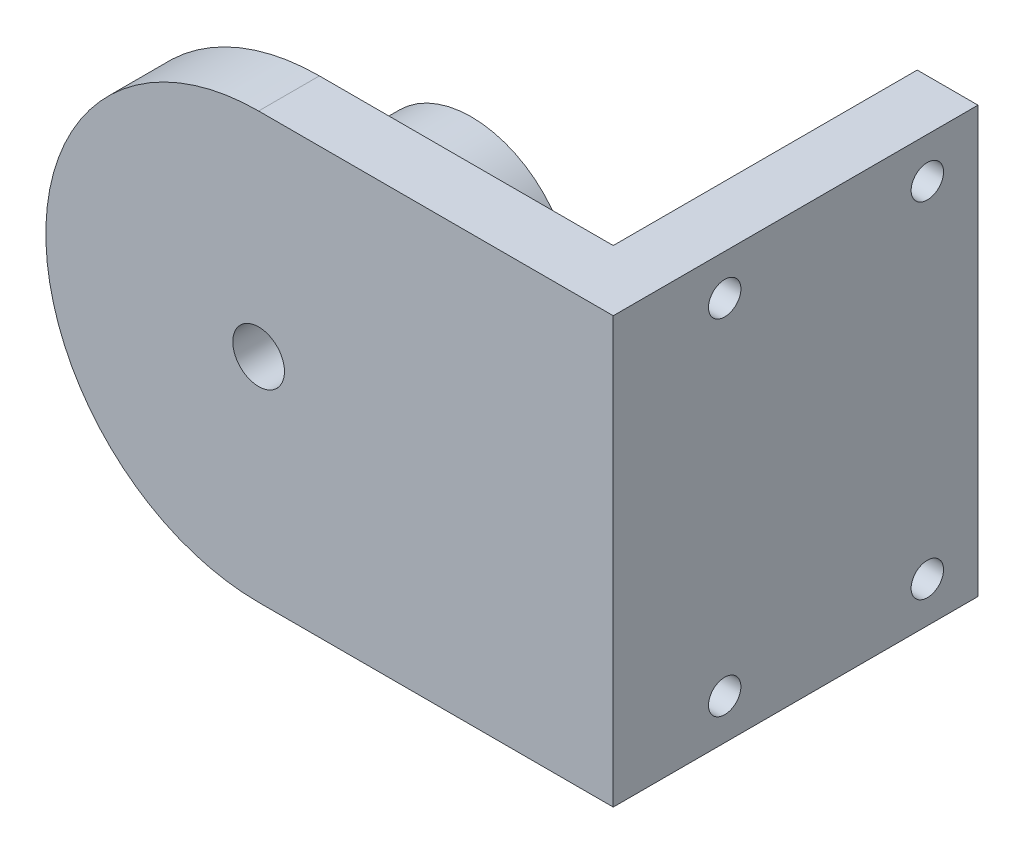
from build123d import *

# Parameters (mm, degrees)
SKETCH_1_R          = 10
SKETCH_1_R_2        = 2.55
EXTRUDE_1_DEPTH     = 15
SKETCH_3_R          = 1.6
CUT_EXTRUDE_1_DEPTH = 28.75853565
EXTRUDE_2_DEPTH     = 6
SKETCH_6_R          = 2.55
CUT_EXTRUDE_2_DEPTH = 10
SKETCH_7_W          = 30
SKETCH_7_H          = 42
EXTRUDE_3_DEPTH     = 6
SKETCH_8_R          = 1.6
CUT_EXTRUDE_3_DEPTH = 6


with BuildPart() as part:
    # 草图1 → 凸台-拉伸1 (new body)
    with BuildSketch(Plane.XY):
        with Locations((-2.14168272, 2.06384273)):
            Circle(SKETCH_1_R)
        with Locations((-2.14168272, 2.06384273)):
            Circle(SKETCH_1_R_2, mode=Mode.SUBTRACT)
    extrude(amount=EXTRUDE_1_DEPTH)

    # 草图3 → 切除-拉伸1 (cut, through all)
    with BuildSketch(Plane(origin=(7.85831728, 0, 0), x_dir=(0, 0, -1), z_dir=(1, 0, 0))):
        with Locations((-7.5, 2.06384273)):
            Circle(SKETCH_3_R)
    extrude(amount=-CUT_EXTRUDE_1_DEPTH, mode=Mode.SUBTRACT)

    # 草图5 → 凸台-拉伸2 (add)
    with BuildSketch(Plane.XY.offset(15)):
        with BuildLine():
            Line((-2.14168272, 23.06384273), (32.85831728, 23.06384273))
            Line((32.85831728, 23.06384273), (32.85831728, -18.93615727))
            Line((32.85831728, -18.93615727), (-2.14168272, -18.93615727))
            ThreePointArc((-2.14168272, -18.93615727), (-23.14168272, 2.06384273), (-2.14168272, 23.06384273))
        make_face()
    extrude(amount=EXTRUDE_2_DEPTH)

    # 草图6 → 切除-拉伸2 (cut)
    with BuildSketch(Plane(origin=(0, 0, 15), x_dir=(-1, 0, 0), z_dir=(0, 0, -1))):
        with Locations((2.14168272, 2.06384273)):
            Circle(SKETCH_6_R)
    extrude(amount=-CUT_EXTRUDE_2_DEPTH, mode=Mode.SUBTRACT)

    # 草图7 → 凸台-拉伸3 (add)
    with BuildSketch(Plane(origin=(32.85831728, 0, 0), x_dir=(0, 0, -1), z_dir=(1, 0, 0))):
        with Locations((0, 2.06384273)):
            Rectangle(SKETCH_7_W, SKETCH_7_H)
    extrude(amount=-EXTRUDE_3_DEPTH)

    # 草图8 → 切除-拉伸3 (cut)
    with BuildSketch(Plane(origin=(32.85831728, 0, 0), x_dir=(0, 0, -1), z_dir=(1, 0, 0))):
        with Locations((-10, 19.06384273)):
            Circle(SKETCH_8_R)
        with Locations((-10, -14.93615727)):
            Circle(SKETCH_8_R)
        with Locations((10, -14.93615727)):
            Circle(SKETCH_8_R)
        with Locations((10, 19.06384273)):
            Circle(SKETCH_8_R)
    extrude(amount=-CUT_EXTRUDE_3_DEPTH, mode=Mode.SUBTRACT)


solid = part.part
